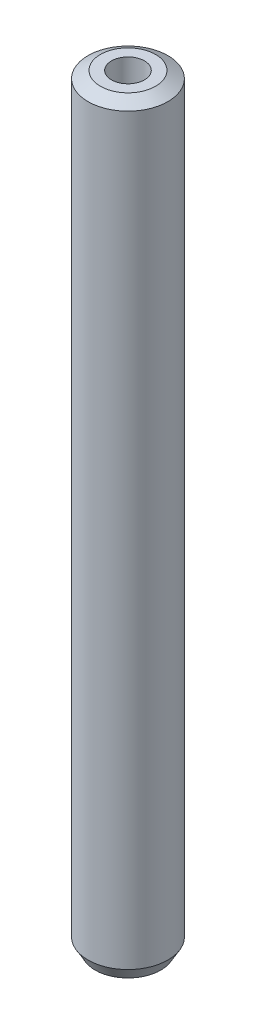
from build123d import *
from OCP.BRepFilletAPI import BRepFilletAPI_MakeChamfer

# Parameters (mm, degrees)
SKETCH1_R           = 10
BOSS_EXTRUDE1_DEPTH = 191.075567301
SKETCH2_R           = 4.133399579
CUT_EXTRUDE1_DEPTH  = 192.598205679
CHAMFER1_SIZE       = 1.785978795
CHAMFER1_SIZE2      = 3.093406015


with BuildPart() as part:
    # Sketch1 → Boss-Extrude1 (new body)
    with BuildSketch(Plane(origin=(0, 0, 0), x_dir=(1, 0, 0), z_dir=(0, 1, 0))):
        Circle(SKETCH1_R)
    extrude(amount=BOSS_EXTRUDE1_DEPTH)

    # Sketch2 → Cut-Extrude1 (cut, through all)
    with BuildSketch(Plane(origin=(0, 0, 0), x_dir=(1, 0, 0), z_dir=(0, 1, 0))):
        Circle(SKETCH2_R)
    extrude(amount=CUT_EXTRUDE1_DEPTH, mode=Mode.SUBTRACT)

    # Chamfer1: one chamfer whose edges measure the first distance from different faces: ONE call of the kernel's chamfer builder (chamfer() names one face for all edges)
    chamfer1_edges_1 = [part.edges().sort_by_distance(p)[0] for p in [
        (-10, 191.075567301, 0),
    ]]
    chamfer1_side_1 = [part.faces().sort_by_distance(p)[0] for p in [
        (-10, 95.537783651, 0),
    ]]
    chamfer1_edges_2 = [part.edges().sort_by_distance(p)[0] for p in [
        (-10, 0, 0),
    ]]
    chamfer1_side_2 = [part.faces().sort_by_distance(p)[0] for p in [
        (-9.717157288, 0, 0),
    ]]
    chamfer1 = BRepFilletAPI_MakeChamfer(part.part.solid().wrapped)
    for e in chamfer1_edges_1:
        chamfer1.Add(CHAMFER1_SIZE, CHAMFER1_SIZE2, e.wrapped, chamfer1_side_1[0].wrapped)  # the first distance lies on this face
    for e in chamfer1_edges_2:
        chamfer1.Add(CHAMFER1_SIZE, CHAMFER1_SIZE2, e.wrapped, chamfer1_side_2[0].wrapped)  # the first distance lies on this face
    add(Compound.cast(chamfer1.Shape()), mode=Mode.REPLACE)


solid = part.part
